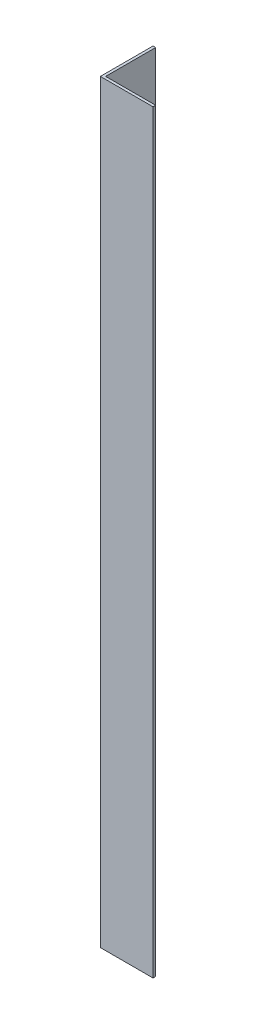
from build123d import *

# Parameters (mm, degrees)
EXTRUDE_1_DEPTH = 215


with BuildPart() as part:
    # Эскиз1 → Бобышка-Вытянуть1 (new body)
    with BuildSketch(Plane(origin=(0, 0, 0), x_dir=(1, 0, 0), z_dir=(0, 1, 0))):
        Polygon((0, 0), (0, 15), (0.75, 15), (0.75, 0.75), (15, 0.75), (15, 0), align=None)
    extrude(amount=EXTRUDE_1_DEPTH)


solid = part.part
